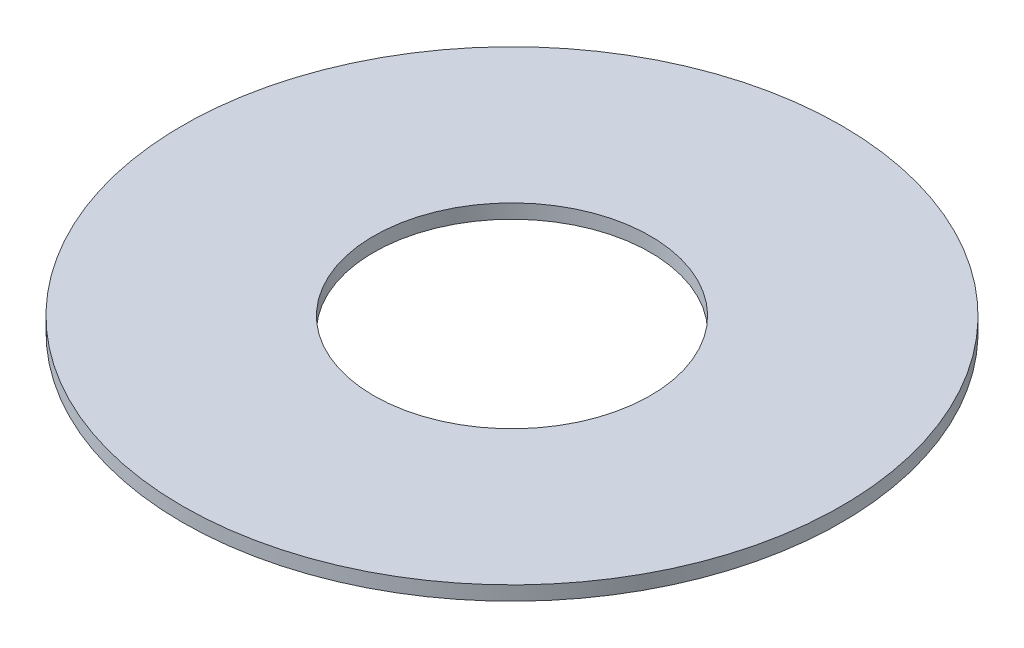
from build123d import *

# Parameters (mm, degrees)
SKETCH1_R           = 46.53
SKETCH1_R_2         = 19.53
BOSS_EXTRUDE1_DEPTH = 2


with BuildPart() as part:
    # Sketch1 → Boss-Extrude1 (new body)
    with BuildSketch(Plane(origin=(0, 0, 0), x_dir=(1, 0, 0), z_dir=(0, 1, 0))):
        Circle(SKETCH1_R)
        Circle(SKETCH1_R_2, mode=Mode.SUBTRACT)
    extrude(amount=BOSS_EXTRUDE1_DEPTH)


solid = part.part
